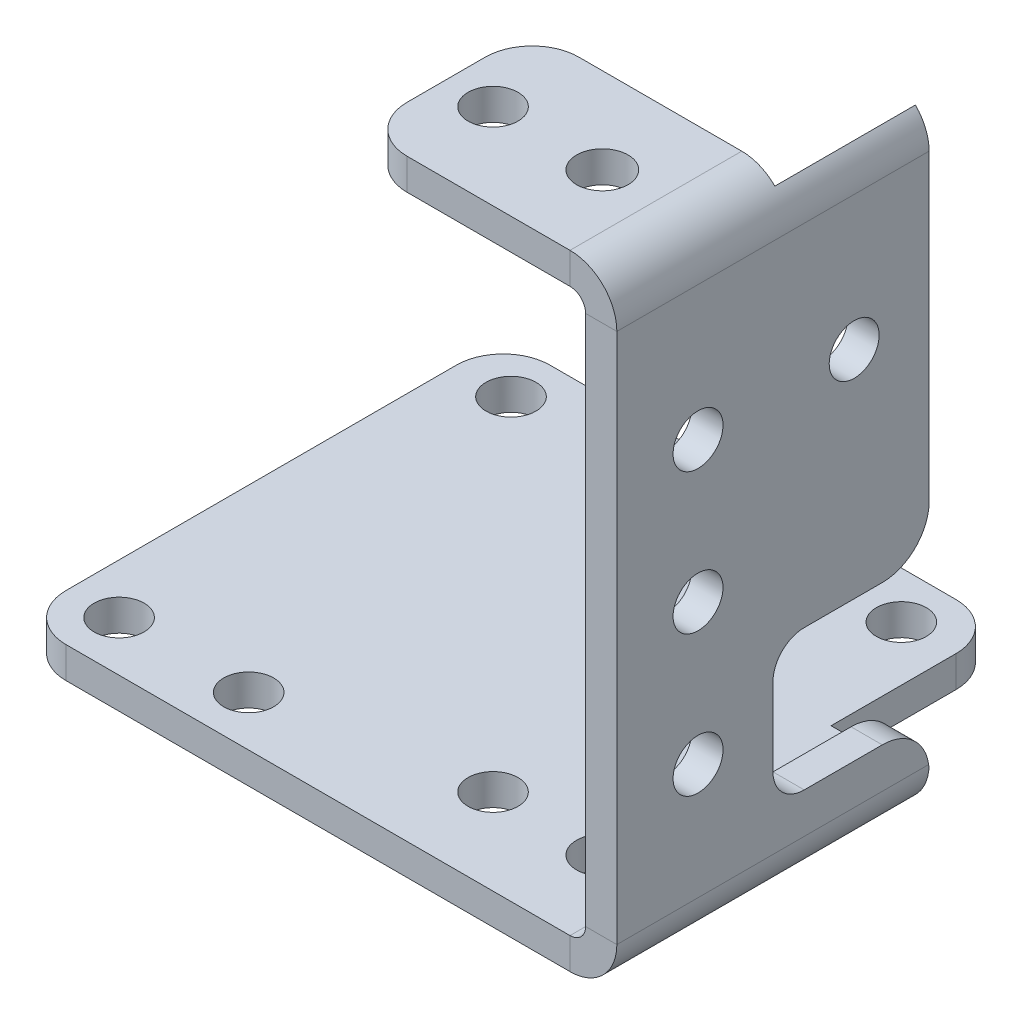
from build123d import *

# Parameters (mm, degrees)
SM_BASE_FLANGE_1_DEPTH = 2
OTHER_START            = -4.5
OTHER_1_DEPTH          = 20
OTHER_1_2_OUTLINE_W    = 2
OTHER_1_2_OUTLINE_H    = 24
OTHER_1_2_DEPTH        = 20
OTHER_START_2          = 5.5
OTHER_1_3_OUTLINE_W    = 2
OTHER_1_3_OUTLINE_H    = 15
OTHER_1_3_OUTLINE_H_2  = 9
OTHER_1_3_DEPTH        = 10
OTHER_START_3          = 4.5
OTHER_1_4_OUTLINE_W    = 2
OTHER_1_4_OUTLINE_H    = 15
OTHER_1_4_DEPTH        = 1
OTHER_2_DEPTH          = 20
OTHER_2_2_DEPTH        = 9
OTHER_2_3_DEPTH        = 11
OTHER_2_4_DEPTH        = 9
SKETCH_4_R             = 1.6
CUT_EXTRUDE_1_DEPTH    = 10
SKETCH_6_R             = 1.6
CUT_EXTRUDE_2_DEPTH    = 10
CUT_EXTRUDE_3_DEPTH    = 67
SKETCH_10_R            = 1.6
CUT_EXTRUDE_4_DEPTH    = 67
FILLET_1_R             = 3
FILLET_2_R             = 2


# Read off the part's stored shape, not the designer's step: 绘制的折弯1, 绘制的折弯2
# Sheet-metal steps are written as plain solids
with BuildPart() as part:
    # Sketch 1 → 基体-法兰1 (new body)
    with BuildSketch(Plane(origin=(0, 0, 0), x_dir=(1, 0, 0), z_dir=(0, 1, 0))):
        Polygon((-16, -15.5), (16, -15.5), (73, -15.5), (73, -4.5), (58, -4.5), (58, 4.5), (34, 4.5), (34, -5.5), (25, -5.5), (25, 4.5), (16, 4.5), (16, 15.5), (-16, 15.5), align=None)
    extrude(amount=-SM_BASE_FLANGE_1_DEPTH)

    # Other 1 outline → Other 1 (cut)
    with BuildSketch(Plane.XY.offset(OTHER_START)):
        with BuildLine():
            ThreePointArc((22.107630798, 0), (21.011254481, -1.449489743), (19.279203673, -2))
            Line((19.279203673, -2), (73, -2))
            Line((73, -2), (73, 0))
            Line((73, 0), (22.107630798, 0))
        make_face()
    extrude(amount=OTHER_1_DEPTH, mode=Mode.SUBTRACT)

    # Other 1 2 outline → Other 1 2 (add)
    with BuildSketch(Plane.XY.offset(OTHER_START)):
        with Locations((21.279203673, 24.579203673)):
            Rectangle(OTHER_1_2_OUTLINE_W, OTHER_1_2_OUTLINE_H)
        with BuildLine():
            Line((22.279203673, 1), (22.279203673, 3.579203673))
            Line((22.279203673, 3.579203673), (20.279203673, 3.579203673))
            Line((20.279203673, 3.579203673), (20.279203673, 1))
            ThreePointArc((20.279203673, 1), (19.986310454, 0.292893219), (19.279203673, 0))
            Line((19.279203673, 0), (22.107630798, 0))
            ThreePointArc((22.107630798, 0), (22.235999352, 0.492694064), (22.279203673, 1))
        make_face()
    extrude(amount=OTHER_1_2_DEPTH)

    # Other 1 3 outline → Other 1 3 (add)
    with BuildSketch(Plane.XY.offset(OTHER_START_2)):
        with Locations((21.279203673, 44.079203673)):
            Rectangle(OTHER_1_3_OUTLINE_W, OTHER_1_3_OUTLINE_H)
        with Locations((21.279203673, 8.079203673)):
            Rectangle(OTHER_1_3_OUTLINE_W, OTHER_1_3_OUTLINE_H_2)
    extrude(amount=OTHER_1_3_DEPTH)

    # Other 1 4 outline → Other 1 4 (add)
    with BuildSketch(Plane.XY.offset(OTHER_START_3)):
        with Locations((21.279203673, 44.079203673)):
            Rectangle(OTHER_1_4_OUTLINE_W, OTHER_1_4_OUTLINE_H)
    extrude(amount=OTHER_1_4_DEPTH)

    # Other 2 outline → Other 2 (cut)
    with BuildSketch(Plane.XY.offset(OTHER_START)):
        with BuildLine():
            ThreePointArc((20.279203673, 37.836834471), (21.728693416, 36.740458154), (22.279203673, 35.008407346))
            Line((22.279203673, 35.008407346), (22.279203673, 51.579203673))
            Line((22.279203673, 51.579203673), (20.279203673, 51.579203673))
            Line((20.279203673, 51.579203673), (20.279203673, 37.836834471))
        make_face()
    extrude(amount=OTHER_2_DEPTH, mode=Mode.SUBTRACT)

    # Other 2 2 outline → Other 2 2 (cut)
    with BuildSketch(Plane.XY.offset(OTHER_START)):
        Polygon((20.279203673, 36.008407347), (20.85, 36.579203673), (20.279203673, 36.579203673), align=None)
    extrude(amount=OTHER_2_2_DEPTH, mode=Mode.SUBTRACT)

    # Other 2 3 outline → Other 2 3 (add)
    with BuildSketch(Plane.XY.offset(OTHER_START_3)):
        with BuildLine():
            ThreePointArc((20.279203673, 37.836834471), (19.786509609, 37.965203025), (19.279203673, 38.008407346))
            Line((19.279203673, 38.008407346), (5.85, 38.008407346))
            Line((5.85, 38.008407346), (5.85, 36.008407346))
            Line((5.85, 36.008407346), (19.279203673, 36.008407346))
            ThreePointArc((19.279203673, 36.008407346), (19.986310455, 35.715514128), (20.279203673, 35.008407346))
            Line((20.279203673, 35.008407346), (20.279203673, 37.836834471))
        make_face()
    extrude(amount=OTHER_2_3_DEPTH)

    # Other 2 4 outline → Other 2 4 (add)
    with BuildSketch(Plane.XY.offset(OTHER_START)):
        with BuildLine():
            ThreePointArc((21.835098605, 36.579203673), (21.633955222, 36.867209419), (21.400524017, 37.12972769))
            Line((21.400524017, 37.12972769), (20.85, 36.579203673))
            Line((20.85, 36.579203673), (21.835098605, 36.579203673))
        make_face()
        with BuildLine():
            Line((20.279203673, 35.008407346), (20.279203673, 36.008407347))
            Line((20.279203673, 36.008407347), (19.986310454, 35.715514128))
            ThreePointArc((19.986310454, 35.715514128), (20.203083206, 35.391090779), (20.279203673, 35.008407346))
        make_face()
    extrude(amount=OTHER_2_4_DEPTH)

    # 草图4 → 切除-拉伸1 (cut)
    with BuildSketch(Plane(origin=(0, -2, 0), x_dir=(-1, 0, 0), z_dir=(0, -1, 0))):
        with Locations(Location((-12.5, 12.5, 0), (0, 0, 90))):
            Circle(SKETCH_4_R)
        with Locations(Location((12.5, 12.5, 0), (0, 0, 90))):
            Circle(SKETCH_4_R)
    extrude(amount=-CUT_EXTRUDE_1_DEPTH, mode=Mode.SUBTRACT)

    # 草图6 → 切除-拉伸2 (cut)
    with BuildSketch(Plane(origin=(0, -2, 0), x_dir=(-1, 0, 0), z_dir=(0, -1, 0))):
        with Locations(Location((12.8, -12.3, 0), (0, 0, 90))):
            Circle(SKETCH_6_R)
        with Locations(Location((4.5, -12.3, 0), (0, 0, 90))):
            Circle(SKETCH_6_R)
    extrude(amount=-CUT_EXTRUDE_2_DEPTH, mode=Mode.SUBTRACT)

    # 草图8 → 切除-拉伸3 (cut)
    with BuildSketch(Plane(origin=(0, 38.008407346, 0), x_dir=(1, 0, 0), z_dir=(0, 1, 0))):
        with BuildLine():
            Line((7.25, -10), (8.85, -10))
            Line((8.85, -10), (10.45, -10))
            ThreePointArc((10.45, -10), (8.85, -8.4), (7.25, -10))
        make_face()
        with BuildLine():
            Line((10.45, -10), (8.85, -10))
            Line((8.85, -10), (7.25, -10))
            ThreePointArc((7.25, -10), (8.85, -11.6), (10.45, -10))
        make_face()
        with BuildLine():
            ThreePointArc((17.5, -10), (15.85, -8.35), (14.2, -10))
            Line((14.2, -10), (15.85, -10))
            Line((15.85, -10), (17.5, -10))
        make_face()
        with BuildLine():
            Line((15.85, -10), (14.2, -10))
            ThreePointArc((14.2, -10), (15.85, -11.65), (17.5, -10))
            Line((17.5, -10), (15.85, -10))
        make_face()
    extrude(amount=-CUT_EXTRUDE_3_DEPTH, mode=Mode.SUBTRACT)

    # 草图10 → 切除-拉伸4 (cut)
    with BuildSketch(Plane.ZY.offset(-20.279203673)):
        with Locations(Location((10.3, 8.408407346, 0), (0, 0, 270))):
            Circle(SKETCH_10_R)
        with Locations(Location((10.3, 17.408407346, 0), (0, 0, 270))):
            Circle(SKETCH_10_R)
        with Locations(Location((10.3, 26.408407346, 0), (0, 0, 270))):
            Circle(SKETCH_10_R)
        with Locations(Location((0.3, 26.408407346, 0), (0, 0, 270))):
            Circle(SKETCH_10_R)
    extrude(amount=-CUT_EXTRUDE_4_DEPTH, mode=Mode.SUBTRACT)

    # 圆角1
    fillet_1_edges = [part.edges().sort_by_distance(p)[0] for p in [
        (21.279203673, 12.579203673, -4.5),
        (21.279203673, 3.579203673, -4.5),
        (16, -1, -15.5),
        (5.85, 37.008407346, 4.5),
        (5.85, 37.008407346, 15.5),
        (-16, -1, 15.5),
        (-16, -1, -15.5),
    ]]
    fillet(fillet_1_edges, radius=FILLET_1_R)

    # 圆角2
    fillet_2_edges = [part.edges().sort_by_distance(p)[0] for p in [
        (21.279203673, 3.579203673, 5.5),
        (21.279203673, 12.579203673, 5.5),
    ]]
    fillet(fillet_2_edges, radius=FILLET_2_R)


solid = part.part
